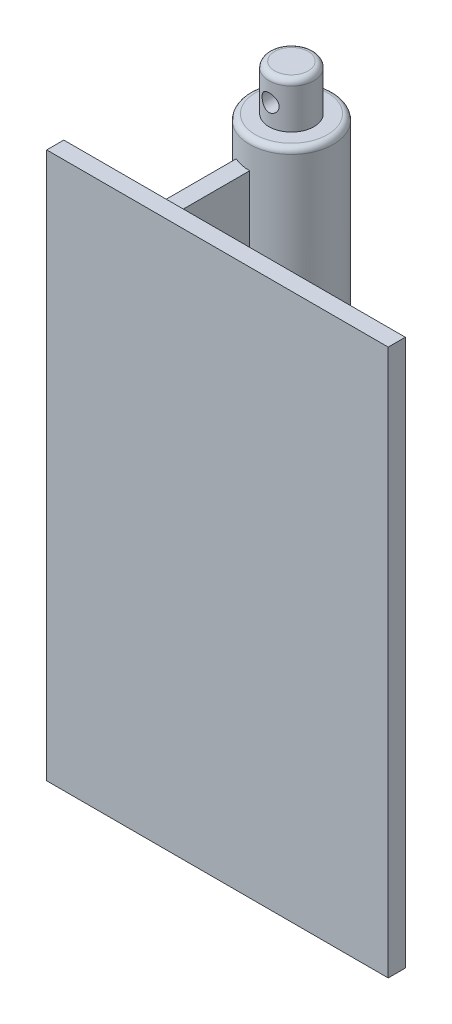
from build123d import *

# Parameters (mm, degrees)
SKETCH_1_W               = 60
SKETCH_1_H               = 96
EXTRUDE_1_DEPTH          = 3
SKETCH_2_W               = 3
SKETCH_2_H               = 84
EXTRUDE_2_DEPTH          = 38
EXTRUDE_3_DEPTH          = 5
EXTRUDE_3_DEPTH_BACK     = 94.122011
SKETCH_4_R               = 7.35
SKETCH_5_R               = 3.95
EXTRUDE_4_DEPTH          = 8
FILLET_2_R               = 1
CUT_EXTRUDE_1_DEPTH      = 124.40908597
CUT_EXTRUDE_1_DEPTH_BACK = 124.40908597
SKETCH_9_R               = 1.5
FILLET_3_R               = 0.5
CUT_EXTRUDE_START        = 6
CUT_EXTRUDE_3_DEPTH      = 84
FILLET_6_R               = 3


# Read off the part's stored shape, not the designer's step: 切除-拉伸3
with BuildPart() as part:
    # 草图1 → 凸台-拉伸1 (new body)
    with BuildSketch(Plane.XY):
        with Locations((30, 48)):
            Rectangle(SKETCH_1_W, SKETCH_1_H)
    extrude(amount=EXTRUDE_1_DEPTH)

    # 草图2 → 凸台-拉伸2 (add)
    with BuildSketch(Plane(origin=(0, 0, 0), x_dir=(-1, 0, 0), z_dir=(0, 0, -1))):
        with Locations((-13.5, 48)):
            Rectangle(SKETCH_2_W, SKETCH_2_H)
    extrude(amount=EXTRUDE_2_DEPTH)

    # 草图4 → 凸台-拉伸3 (add, two sides: drawn at the far end of the back side and taken through both)
    with BuildSketch(Plane(origin=(0, 90, 0), x_dir=(1, 0, 0), z_dir=(0, 1, 0)).offset(-EXTRUDE_3_DEPTH_BACK)):
        with Locations(Location((15, 25, 0), (0, 0, 180))):
            Circle(SKETCH_4_R)
    extrude(amount=EXTRUDE_3_DEPTH + EXTRUDE_3_DEPTH_BACK)

    # 草图5 → 凸台-拉伸4 (add)
    with BuildSketch(Plane(origin=(0, 95, 0), x_dir=(1, 0, 0), z_dir=(0, 1, 0))):
        with Locations(Location((15, 25, 0), (0, 0, 270))):
            Circle(SKETCH_5_R)
    extrude(amount=EXTRUDE_4_DEPTH)

    # 圆角2
    fillet_2_edges = [part.edges().sort_by_distance(p)[0] for p in [
        (22.35, 95, -25),
        (15, 103, -28.95),
    ]]
    fillet(fillet_2_edges, radius=FILLET_2_R)

    # 草图9 → 切除-拉伸1 (cut, two sides: drawn at the far end of the back side and taken through both)
    with BuildSketch(Plane(origin=(0, 0, -28.95), x_dir=(-1, 0, 0), z_dir=(0, 0, -1)).offset(-CUT_EXTRUDE_1_DEPTH_BACK)):
        with Locations(Location((-15, 98.677988735, 0), (0, 0, 90.000000013))):
            Circle(SKETCH_9_R)
    extrude(amount=CUT_EXTRUDE_1_DEPTH + CUT_EXTRUDE_1_DEPTH_BACK, mode=Mode.SUBTRACT)

    # 圆角3
    fillet_3_edges = [part.edges().sort_by_distance(p)[0] for p in [
        (22.35, -4.122011, -25),
    ]]
    fillet(fillet_3_edges, radius=FILLET_3_R)

    # 切除-拉伸3 outline → 切除-拉伸3 (cut)
    with BuildSketch(Plane(origin=(0, 0, 0), x_dir=(1, 0, 0), z_dir=(0, 1, 0)).offset(CUT_EXTRUDE_START)):
        with BuildLine():
            Line((12, 38), (12, 31.709880774))
            ThreePointArc((12, 31.709880774), (13.466233996, 32.188189052), (15, 32.35))
            Line((15, 32.35), (15, 38))
            Line((15, 38), (12, 38))
        make_face()
    extrude(amount=CUT_EXTRUDE_3_DEPTH, mode=Mode.SUBTRACT)

    # 圆角6
    fillet_6_edges = [part.edges().sort_by_distance(p)[0] for p in [
        (12, 48, 0),
        (15, 48, 0),
    ]]
    fillet(fillet_6_edges, radius=FILLET_6_R)


solid = part.part
